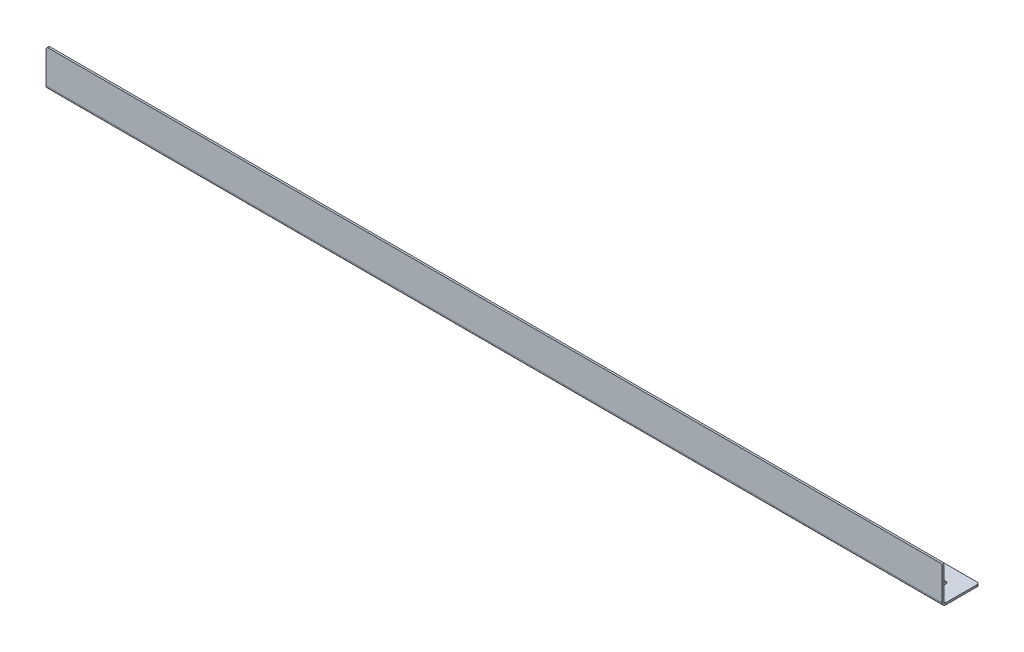
from build123d import *

# Parameters (mm, degrees)
BASE_FLANGE1_DEPTH               = 2.5908
EDGE_FLANGE1_STRIP_W             = 15.4432
EDGE_FLANGE1_STRIP_H             = 2.5908
EDGE_FLANGE1_STRIP_CUT_DEPTH     = 1219.2
EDGE_FLANGE1_DEPTH               = 1219.2
F_17_64_0_26563_DIAMETER_HOLE1_D = 6.747002
FILLET1_R                        = 3.175
F_17_64_0_26563_DIAMETER_HOLE2_D = 6.747002
F_17_64_0_26563_DIAMETER_HOLE3_D = 6.747002


# Sheet-metal steps are written as plain solids
with BuildPart() as part:
    # Sketch2 → Base-Flange1 (new body)
    with BuildSketch(Plane(origin=(0, 0, 0), x_dir=(1, 0, 0), z_dir=(0, 1, 0))):
        Polygon((0, 0), (1219.2, 0), (1219.2, 50.8), (-19.05, 50.8), (-19.05, 19.05), (0, 9.525), align=None)
    extrude(amount=-BASE_FLANGE1_DEPTH)

    # Edge-Flange1 strip (across the edge) → Edge-Flange1 strip cut (cut)
    with BuildSketch(Plane(origin=(0, 0, 0), x_dir=(0, 0, -1), z_dir=(1, 0, 0))):
        with Locations((-2.5908, -1.2954)):
            Rectangle(EDGE_FLANGE1_STRIP_W, EDGE_FLANGE1_STRIP_H)
    extrude(amount=EDGE_FLANGE1_STRIP_CUT_DEPTH, mode=Mode.SUBTRACT)

    # Edge-Flange1 section (across the edge) → Edge-Flange1 (add)
    with BuildSketch(Plane(origin=(0, 0, 0), x_dir=(0, 0, -1), z_dir=(1, 0, 0))):
        with BuildLine():
            Line((0, 2.54), (0, 48.2092))
            Line((0, 48.2092), (2.5908, 48.2092))
            Line((2.5908, 48.2092), (2.5908, 2.54))
            ThreePointArc((2.5908, 2.54), (3.334748776, 0.743948776), (5.1308, 0))
            Line((5.1308, 0), (5.1308, -2.5908))
            ThreePointArc((5.1308, -2.5908), (1.502776527, -1.088023473), (0, 2.54))
        make_face()
    extrude(amount=EDGE_FLANGE1_DEPTH)

    # 17/64 (0.26563) Diameter Hole1 (through all)
    with Locations(Plane(origin=(0, 0, 0), x_dir=(1, 0, 0), z_dir=(0, 1, 0))):
        with Locations((1193.8, 27.305)):
            Hole(F_17_64_0_26563_DIAMETER_HOLE1_D / 2)

    # Fillet1
    fillet1_edges = [part.edges().sort_by_distance(p)[0] for p in [
        (0, -1.2954, -9.525),
        (-19.05, -1.2954, -19.05),
        (-19.05, -1.2954, -50.8),
        (1219.2, -1.2954, -50.8),
        (0, 48.2092, -1.2954),
        (1219.2, 48.2092, -1.2954),
    ]]
    fillet(fillet1_edges, radius=FILLET1_R)

    # 17/64 (0.26563) Diameter Hole2 (through all)
    with Locations(Plane(origin=(0, 0, 0), x_dir=(1, 0, 0), z_dir=(0, 1, 0))):
        with Locations((3.81, 33.3375)):
            Hole(F_17_64_0_26563_DIAMETER_HOLE2_D / 2)

    # 17/64 (0.26563) Diameter Hole3 (through all)
    with Locations(Plane(origin=(0, -2.5908, 0), x_dir=(-1, 0, 0), z_dir=(0, -1, 0))):
        with Locations((-103.6574, 33.655), (-1102.8934, 33.655)):
            Hole(F_17_64_0_26563_DIAMETER_HOLE3_D / 2)


solid = part.part
